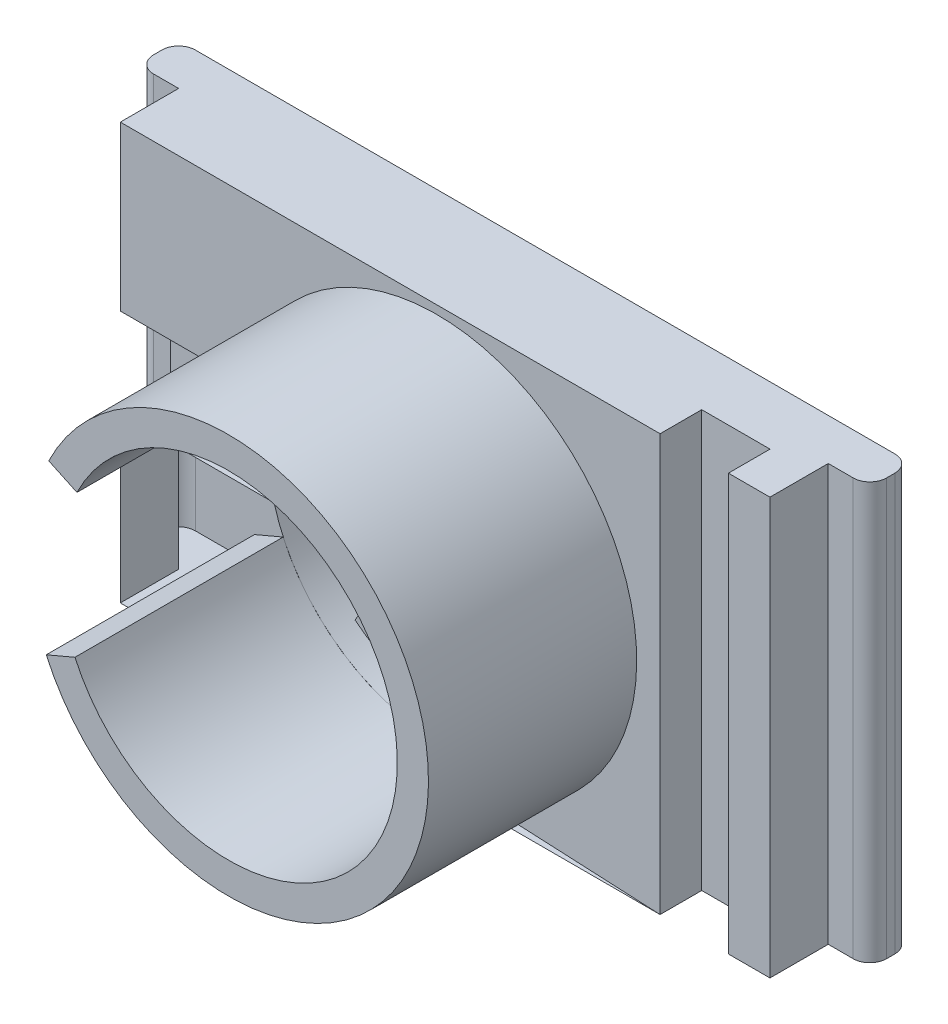
from build123d import *

# Parameters (mm, degrees)
SKETCH1_W           = 65
SKETCH1_H           = 50
BOSS_EXTRUDE1_DEPTH = 12
CUT_EXTRUDE1_DEPTH  = 6
SKETCH3_R           = 9
CUT_EXTRUDE2_DEPTH  = 42.43971525
SKETCH4_R           = 20.25
CUT_EXTRUDE3_DEPTH  = 3
SKETCH5_W           = 12
SKETCH5_H           = 50
BOSS_EXTRUDE2_DEPTH = 13
SKETCH6_W           = 8.2
SKETCH6_H           = 50
CUT_EXTRUDE4_DEPTH  = 5
SKETCH7_W           = 5
SKETCH7_H           = 50
BOSS_EXTRUDE3_DEPTH = 5
SKETCH8_W           = 5
SKETCH8_H           = 50
BOSS_EXTRUDE4_DEPTH = 5
FILLET1_R           = 2
FILLET2_R           = 2
BOSS_EXTRUDE6_DEPTH = 25
FILLET3_R           = 2
FILLET4_R           = 2


with BuildPart() as part:
    # Sketch1 → Boss-Extrude1 (new body)
    with BuildSketch(Plane.XY):
        Rectangle(SKETCH1_W, SKETCH1_H)
    extrude(amount=BOSS_EXTRUDE1_DEPTH)

    # Sketch2 → Cut-Extrude1 (cut)
    with BuildSketch(Plane.XY.offset(12)):
        with BuildLine():
            Line((-0.079165483, -16.163398081), (-1.679165483, -18.934679373))
            ThreePointArc((-1.679165483, -18.934679373), (15.625, -17.537014427), (25.487496091, -3.25))
            Line((25.487496091, -3.25), (22.287496091, -3.25))
            Line((22.287496091, -3.25), (22.287496091, 3.25))
            Line((22.287496091, 3.25), (25.487496091, 3.25))
            ThreePointArc((25.487496091, 3.25), (15.625, 17.537014427), (-1.679165483, 18.934679373))
            Line((-1.679165483, 18.934679373), (-0.079165483, 16.163398081))
            Line((-0.079165483, 16.163398081), (-5.708330608, 12.913398081))
            Line((-5.708330608, 12.913398081), (-7.308330608, 15.684679373))
            ThreePointArc((-7.308330608, 15.684679373), (-11.475017308, 11.041344456), (-14.030488985, 5.35))
            Line((-14.030488985, 5.35), (-44.030488985, 5.35))
            Line((-44.030488985, 5.35), (-44.030488985, -5.35))
            Line((-44.030488985, -5.35), (-14.030488985, -5.35))
            ThreePointArc((-14.030488985, -5.35), (-11.475017308, -11.041344456), (-7.308330608, -15.684679373))
            Line((-7.308330608, -15.684679373), (-5.708330608, -12.913398081))
            Line((-5.708330608, -12.913398081), (-0.079165483, -16.163398081))
        make_face()
    extrude(amount=-CUT_EXTRUDE1_DEPTH, mode=Mode.SUBTRACT)

    # Sketch3 → Cut-Extrude2 (cut, through all)
    with BuildSketch(Plane.XY.offset(6)):
        with Locations((5.5, 0)):
            Circle(SKETCH3_R)
    extrude(amount=-CUT_EXTRUDE2_DEPTH, mode=Mode.SUBTRACT)

    # Sketch4 → Cut-Extrude3 (cut)
    with BuildSketch(Plane.XY.offset(12)):
        with Locations((5.5, 0)):
            Circle(SKETCH4_R)
    extrude(amount=-CUT_EXTRUDE3_DEPTH, mode=Mode.SUBTRACT)

    # Sketch5 → Boss-Extrude2 (add)
    with BuildSketch(Plane(origin=(32.5, 0, 0), x_dir=(0, 0, -1), z_dir=(1, 0, 0))):
        with Locations((-6, 0)):
            Rectangle(SKETCH5_W, SKETCH5_H)
    extrude(amount=BOSS_EXTRUDE2_DEPTH)

    # Sketch6 → Cut-Extrude4 (cut)
    with BuildSketch(Plane.XY.offset(12)):
        with Locations((36.409019421, 0)):
            Rectangle(SKETCH6_W, SKETCH6_H)
    extrude(amount=-CUT_EXTRUDE4_DEPTH, mode=Mode.SUBTRACT)

    # Sketch7 → Boss-Extrude3 (add)
    with BuildSketch(Plane(origin=(45.5, 0, 0), x_dir=(0, 0, -1), z_dir=(1, 0, 0))):
        with Locations((-2.5, 0)):
            Rectangle(SKETCH7_W, SKETCH7_H)
    extrude(amount=BOSS_EXTRUDE3_DEPTH)

    # Sketch8 → Boss-Extrude4 (add)
    with BuildSketch(Plane.ZY.offset(32.5)):
        with Locations((2.5, 0)):
            Rectangle(SKETCH8_W, SKETCH8_H)
    extrude(amount=BOSS_EXTRUDE4_DEPTH)

    # Fillet1
    fillet1_edges = [part.edges().sort_by_distance(p)[0] for p in [
        (50.5, 0, 5),
    ]]
    fillet(fillet1_edges, radius=FILLET1_R)

    # Fillet2
    fillet2_edges = [part.edges().sort_by_distance(p)[0] for p in [
        (-37.5, 0, 5),
    ]]
    fillet(fillet2_edges, radius=FILLET2_R)

    # Sketch9 → Boss-Extrude6 (add)
    with BuildSketch(Plane.XY.offset(12)):
        with BuildLine():
            Line((-16.092960793, 10.475879161), (-12.705503837, 8.889726094))
            ThreePointArc((-12.705503837, 8.889726094), (10.062022154, 19.739694878), (25.76, 0))
            ThreePointArc((25.76, 0), (9.783964079, -19.801900206), (-12.948317056, -8.374198339))
            Line((-12.948317056, -8.374198339), (-16.391781636, -9.83615254))
            ThreePointArc((-16.391781636, -9.83615254), (10.529773391, -23.467027499), (29.5, 0))
            ThreePointArc((29.5, 0), (10.874427457, 23.390500839), (-16.092960793, 10.475879161))
        make_face()
    extrude(amount=BOSS_EXTRUDE6_DEPTH)

    # Fillet3
    fillet3_edges = [part.edges().sort_by_distance(p)[0] for p in [
        (-37.5, 0, 0),
    ]]
    fillet(fillet3_edges, radius=FILLET3_R)

    # Fillet4
    fillet4_edges = [part.edges().sort_by_distance(p)[0] for p in [
        (50.5, 0, 0),
    ]]
    fillet(fillet4_edges, radius=FILLET4_R)


solid = part.part
